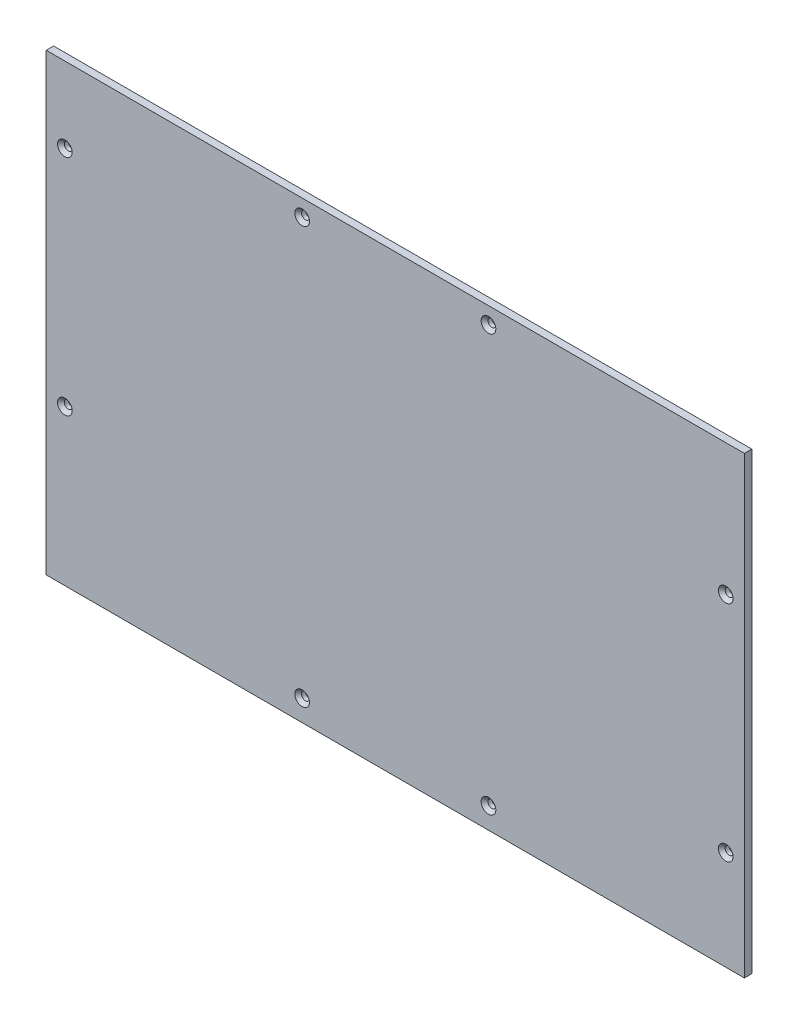
from build123d import *

# Parameters (mm, degrees)
SKETCH1_W                                       = 299.7
SKETCH1_H                                       = 195.04375
BOSS_EXTRUDE1_DEPTH                             = 3.175
CSK_FOR_M3_FLAT_HEAD_MACHINE_SCREW1_D           = 3.4
CSK_FOR_M3_FLAT_HEAD_MACHINE_SCREW1_CSINK_D     = 6.3
CSK_FOR_M3_FLAT_HEAD_MACHINE_SCREW1_CSINK_ANGLE = 90


with BuildPart() as part:
    # Sketch1 → Boss-Extrude1 (new body)
    with BuildSketch(Plane.XY):
        Rectangle(SKETCH1_W, SKETCH1_H)
    extrude(amount=BOSS_EXTRUDE1_DEPTH)

    # CSK for M3 Flat Head Machine Screw1 (through all)
    with Locations(Plane.XY.offset(3.175)):
        with Locations((-40, 90.378125052), (40, 90.378125052), (141.850000066, 41.078125052), (141.850000066, -54.921874948), (40, -88.427624948), (-40, -88.427624948), (-141.850000066, -30.921874948), (-141.850000066, 65.078125052)):
            CounterSinkHole(CSK_FOR_M3_FLAT_HEAD_MACHINE_SCREW1_D / 2, CSK_FOR_M3_FLAT_HEAD_MACHINE_SCREW1_CSINK_D / 2, counter_sink_angle=CSK_FOR_M3_FLAT_HEAD_MACHINE_SCREW1_CSINK_ANGLE)


solid = part.part
